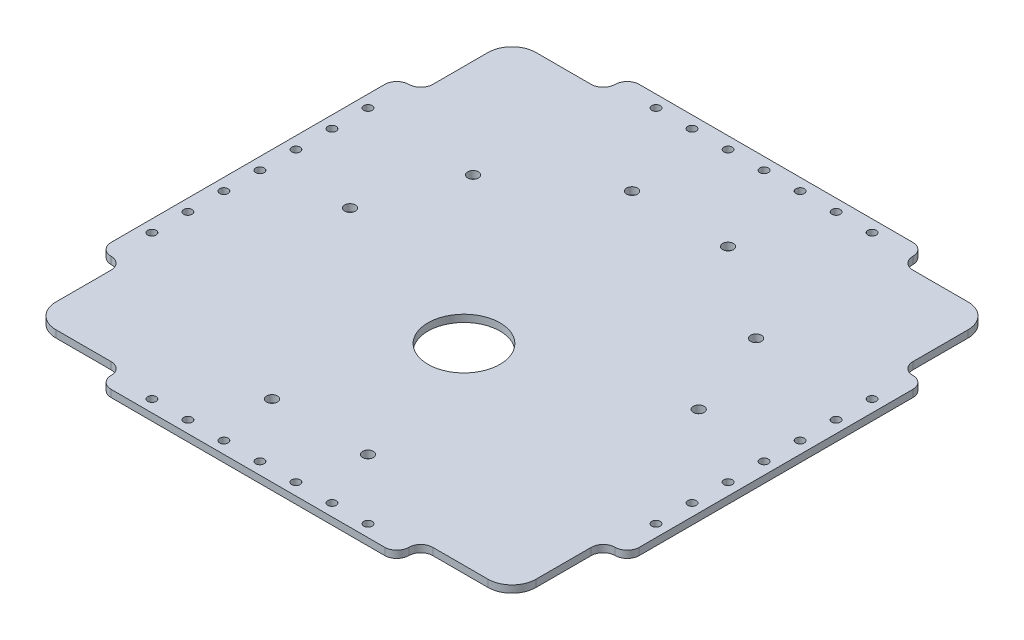
from build123d import *

# Parameters (mm, degrees)
SKETCH_1_W          = 220
SKETCH_1_H          = 220
SKETCH_1_R          = 2.25
EXTRUDE_1_DEPTH     = 3
CUT_EXTRUDE_1_DEPTH = 156.592416268
FILLET_1_R          = 10
FILLET_START        = -1
FILLET_2_DEPTH      = 5
FILLET_2_2_DEPTH    = 3
SKETCH_4_R          = 1.75
CUT_EXTRUDE_2_DEPTH = 156.592416268
SKETCH1_R           = 15
CUT_EXTRUDE1_DEPTH  = 156.592416268


with BuildPart() as part:
    # Эскиз1 → Бобышка-Вытянуть1 (new body)
    with BuildSketch(Plane(origin=(0, 0, 0), x_dir=(1, 0, 0), z_dir=(0, 1, 0))):
        Rectangle(SKETCH_1_W, SKETCH_1_H)
        with Locations(Location((-20, 70, 0), (0, 0, 270))):
            Circle(SKETCH_1_R, mode=Mode.SUBTRACT)
        with Locations(Location((20, 70, 0), (0, 0, 90))):
            Circle(SKETCH_1_R, mode=Mode.SUBTRACT)
        with Locations(Location((-20, -80, 0), (0, 0, 90))):
            Circle(SKETCH_1_R, mode=Mode.SUBTRACT)
        with Locations(Location((20, -80, 0), (0, 0, 270))):
            Circle(SKETCH_1_R, mode=Mode.SUBTRACT)
        with Locations(Location((58.938080589, 42.735262449, 0), (0, 0, 270))):
            Circle(SKETCH_1_R, mode=Mode.SUBTRACT)
        with Locations(Location((72.618886322, 5.147557617, 0), (0, 0, 90))):
            Circle(SKETCH_1_R, mode=Mode.SUBTRACT)
        with Locations(Location((-72.618886322, 5.147557617, 0), (0, 0, 270))):
            Circle(SKETCH_1_R, mode=Mode.SUBTRACT)
        with Locations(Location((-58.938080589, 42.735262449, 0), (0, 0, 90))):
            Circle(SKETCH_1_R, mode=Mode.SUBTRACT)
    extrude(amount=EXTRUDE_1_DEPTH)

    # Эскиз3 → Вырез-Вытянуть1 (cut, through all)
    with BuildSketch(Plane(origin=(0, 3, 0), x_dir=(1, 0, 0), z_dir=(0, 1, 0))):
        Polygon((-110, 110), (-62, 110), (-62, 100), (-100, 100), (-100, 62), (-110, 62), align=None)
        Polygon((110, 62), (110, 110), (62, 110), (62, 100), (100, 100), (100, 62), align=None)
        Polygon((110, -110), (62, -110), (62, -100), (100, -100), (100, -62), (110, -62), align=None)
        Polygon((-110, -62), (-110, -110), (-62, -110), (-62, -100), (-100, -100), (-100, -62), align=None)
    extrude(amount=-CUT_EXTRUDE_1_DEPTH, mode=Mode.SUBTRACT)

    # Скругление1
    fillet_1_edges = [part.edges().sort_by_distance(p)[0] for p in [
        (-100, 1.5, 100),
        (100, 1.5, 100),
        (100, 1.5, -100),
        (-100, 1.5, -100),
    ]]
    fillet(fillet_1_edges, radius=FILLET_1_R)

    # Скругление2: read off the stored shape, not the designer's step
    # Скругление2 outline → Скругление2 (cut)
    with BuildSketch(Plane(origin=(0, 0, 0), x_dir=(1, 0, 0), z_dir=(0, 1, 0)).offset(FILLET_START)):
        with BuildLine():
            ThreePointArc((-105, -62), (-108.535533906, -60.535533906), (-110, -57))
            Line((-110, -57), (-110, -62))
            Line((-110, -62), (-105, -62))
        make_face()
        with BuildLine():
            ThreePointArc((-110, 57), (-108.535533906, 60.535533906), (-105, 62))
            Line((-105, 62), (-110, 62))
            Line((-110, 62), (-110, 57))
        make_face()
        with BuildLine():
            Line((62, 110), (57, 110))
            ThreePointArc((57, 110), (60.535533906, 108.535533906), (62, 105))
            Line((62, 105), (62, 110))
        make_face()
        with BuildLine():
            ThreePointArc((-62, 105), (-60.535533906, 108.535533906), (-57, 110))
            Line((-57, 110), (-62, 110))
            Line((-62, 110), (-62, 105))
        make_face()
        with BuildLine():
            ThreePointArc((62, -105), (60.535533906, -108.535533906), (57, -110))
            Line((57, -110), (62, -110))
            Line((62, -110), (62, -105))
        make_face()
        with BuildLine():
            ThreePointArc((-57, -110), (-60.535533906, -108.535533906), (-62, -105))
            Line((-62, -105), (-62, -110))
            Line((-62, -110), (-57, -110))
        make_face()
        with BuildLine():
            ThreePointArc((105, 62), (108.535533906, 60.535533906), (110, 57))
            Line((110, 57), (110, 62))
            Line((110, 62), (105, 62))
        make_face()
        with BuildLine():
            ThreePointArc((110, -57), (108.535533906, -60.535533906), (105, -62))
            Line((105, -62), (110, -62))
            Line((110, -62), (110, -57))
        make_face()
    extrude(amount=FILLET_2_DEPTH, mode=Mode.SUBTRACT)

    # Fillet 2 2 outline → Fillet 2 2 (add)
    with BuildSketch(Plane(origin=(0, 0, 0), x_dir=(1, 0, 0), z_dir=(0, 1, 0))):
        with BuildLine():
            Line((-100, 62), (-100, 67))
            ThreePointArc((-100, 67), (-101.464466094, 63.464466094), (-105, 62))
            Line((-105, 62), (-100, 62))
        make_face()
        with BuildLine():
            Line((-100, -62), (-105, -62))
            ThreePointArc((-105, -62), (-101.464466094, -63.464466094), (-100, -67))
            Line((-100, -67), (-100, -62))
        make_face()
        with BuildLine():
            Line((-62, 100), (-62, 105))
            ThreePointArc((-62, 105), (-63.464466094, 101.464466094), (-67, 100))
            Line((-67, 100), (-62, 100))
        make_face()
        with BuildLine():
            ThreePointArc((67, 100), (63.464466094, 101.464466094), (62, 105))
            Line((62, 105), (62, 100))
            Line((62, 100), (67, 100))
        make_face()
        with BuildLine():
            Line((62, -100), (62, -105))
            ThreePointArc((62, -105), (63.464466094, -101.464466094), (67, -100))
            Line((67, -100), (62, -100))
        make_face()
        with BuildLine():
            ThreePointArc((-67, -100), (-63.464466094, -101.464466094), (-62, -105))
            Line((-62, -105), (-62, -100))
            Line((-62, -100), (-67, -100))
        make_face()
        with BuildLine():
            Line((100, 62), (105, 62))
            ThreePointArc((105, 62), (101.464466094, 63.464466094), (100, 67))
            Line((100, 67), (100, 62))
        make_face()
        with BuildLine():
            ThreePointArc((100, -67), (101.464466094, -63.464466094), (105, -62))
            Line((105, -62), (100, -62))
            Line((100, -62), (100, -67))
        make_face()
    extrude(amount=FILLET_2_2_DEPTH)

    # Эскиз4 → Вырез-Вытянуть2 (cut, through all)
    with BuildSketch(Plane(origin=(0, 3, 0), x_dir=(1, 0, 0), z_dir=(0, 1, 0))):
        with Locations(Location((0, 105, 0), (0, 0, 270))):
            Circle(SKETCH_4_R)
        with Locations(Location((15, 105, 0), (0, 0, 270))):
            Circle(SKETCH_4_R)
        with Locations(Location((30, 105, 0), (0, 0, 270))):
            Circle(SKETCH_4_R)
        with Locations(Location((45, 105, 0), (0, 0, 270))):
            Circle(SKETCH_4_R)
        with Locations(Location((-15, 105, 0), (0, 0, 270))):
            Circle(SKETCH_4_R)
        with Locations(Location((-30, 105, 0), (0, 0, 270))):
            Circle(SKETCH_4_R)
        with Locations(Location((-45, 105, 0), (0, 0, 270))):
            Circle(SKETCH_4_R)
        with Locations(Location((105, 0, 0), (0, 0, 270))):
            Circle(SKETCH_4_R)
        with Locations(Location((105, -15, 0), (0, 0, 270))):
            Circle(SKETCH_4_R)
        with Locations(Location((105, -30, 0), (0, 0, 270))):
            Circle(SKETCH_4_R)
        with Locations(Location((105, -45, 0), (0, 0, 270))):
            Circle(SKETCH_4_R)
        with Locations(Location((105, 15, 0), (0, 0, 270))):
            Circle(SKETCH_4_R)
        with Locations(Location((105, 30, 0), (0, 0, 270))):
            Circle(SKETCH_4_R)
        with Locations(Location((105, 45, 0), (0, 0, 270))):
            Circle(SKETCH_4_R)
        with Locations(Location((0, -105, 0), (0, 0, 270))):
            Circle(SKETCH_4_R)
        with Locations(Location((-15, -105, 0), (0, 0, 270))):
            Circle(SKETCH_4_R)
        with Locations(Location((-30, -105, 0), (0, 0, 270))):
            Circle(SKETCH_4_R)
        with Locations(Location((-45, -105, 0), (0, 0, 270))):
            Circle(SKETCH_4_R)
        with Locations(Location((15, -105, 0), (0, 0, 270))):
            Circle(SKETCH_4_R)
        with Locations(Location((30, -105, 0), (0, 0, 270))):
            Circle(SKETCH_4_R)
        with Locations(Location((45, -105, 0), (0, 0, 270))):
            Circle(SKETCH_4_R)
        with Locations(Location((-105, 0, 0), (0, 0, 270))):
            Circle(SKETCH_4_R)
        with Locations(Location((-105, 15, 0), (0, 0, 270))):
            Circle(SKETCH_4_R)
        with Locations(Location((-105, 30, 0), (0, 0, 270))):
            Circle(SKETCH_4_R)
        with Locations(Location((-105, 45, 0), (0, 0, 270))):
            Circle(SKETCH_4_R)
        with Locations(Location((-105, -15, 0), (0, 0, 270))):
            Circle(SKETCH_4_R)
        with Locations(Location((-105, -30, 0), (0, 0, 270))):
            Circle(SKETCH_4_R)
        with Locations(Location((-105, -45, 0), (0, 0, 270))):
            Circle(SKETCH_4_R)
    extrude(amount=-CUT_EXTRUDE_2_DEPTH, mode=Mode.SUBTRACT)

    # Sketch1 → Cut-Extrude1 (cut, through all)
    with BuildSketch(Plane(origin=(0, 3, 0), x_dir=(1, 0, 0), z_dir=(0, 1, 0))):
        with Locations(Location((0, -20, 0), (0, 0, 270))):
            Circle(SKETCH1_R)
    extrude(amount=-CUT_EXTRUDE1_DEPTH, mode=Mode.SUBTRACT)


solid = part.part
